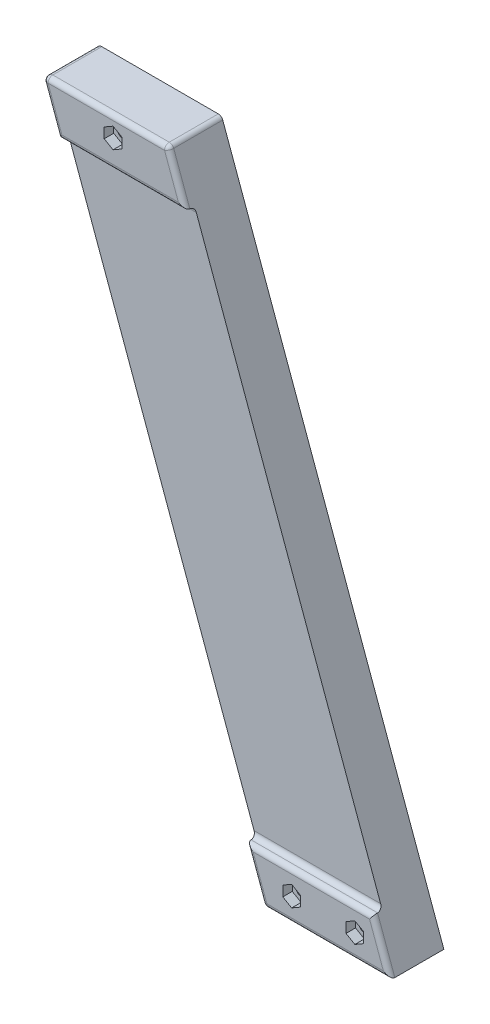
from build123d import *

# Parameters (mm, degrees)
SKETCH2_R           = 1.6
BOSS_EXTRUDE1_DEPTH = 17
SKETCH2_17_R        = 1.6
BOSS_EXTRUDE2_DEPTH = 6
CUT_EXTRUDE1_DEPTH  = 3
CUT_EXTRUDE2_DEPTH  = 3
FILLET1_R           = 1.5
CHAMFER3_SIZE       = 1


# Some blends are built 0.0001 mm under size
with BuildPart() as part:
    # Sketch2 → Boss-Extrude1 (new body)
    with BuildSketch(Plane.XY):
        Polygon((-47.316130455, 164.5), (-52.0477435, 177.5), (-55.240276817, 177.5), (-119.71566449, 354.644671741), (-104.09954666, 354.644671741), (-104.09954666, 349.79492948), (-101.29954666, 348.178348727), (-98.49954666, 349.79492948), (-98.49954666, 354.644671741), (-86.075962148, 354.644671741), (-16.868961429, 164.5), (-13.676428112, 164.5), (-83.975339533, 357.644671741), (-124.00010851, 357.644671741), (-53.701197089, 164.5), align=None)
        with Locations((-101.29954666, 351.411510234)):
            Circle(SKETCH2_R, mode=Mode.SUBTRACT)
    extrude(amount=-BOSS_EXTRUDE1_DEPTH)

    # Sketch2<17> → Boss-Extrude2 (add)
    with BuildSketch(Plane.XY):
        Polygon((-52.0477435, 177.5), (-47.316130455, 164.5), (-16.868961429, 164.5), (-86.075962148, 354.644671741), (-98.49954666, 354.644671741), (-98.49954666, 349.79492948), (-101.29954666, 348.178348727), (-104.09954666, 349.79492948), (-104.09954666, 354.644671741), (-119.71566449, 354.644671741), (-55.240276817, 177.5), align=None)
        with Locations((-44.822322699, 172)):
            Circle(SKETCH2_17_R, mode=Mode.SUBTRACT)
        with Locations((-24.822322699, 172)):
            Circle(SKETCH2_17_R, mode=Mode.SUBTRACT)
    extrude(amount=-BOSS_EXTRUDE2_DEPTH)

    # Sketch2<18> → Cut-Extrude1 (cut)
    with BuildSketch(Plane.XY):
        Polygon((-24.822322699, 168.766838493), (-22.022322699, 170.383419246), (-22.022322699, 173.616580754), (-24.822322699, 175.233161507), (-27.622322699, 173.616580754), (-27.622322699, 170.383419246), align=None)
        Polygon((-44.822322699, 168.766838493), (-42.022322699, 170.383419246), (-42.022322699, 173.616580754), (-44.822322699, 175.233161507), (-47.622322699, 173.616580754), (-47.622322699, 170.383419246), align=None)
        Polygon((-101.29954666, 354.644671741), (-104.09954666, 353.028090988), (-104.09954666, 349.79492948), (-101.29954666, 348.178348727), (-98.49954666, 349.79492948), (-98.49954666, 353.028090988), align=None)
    extrude(amount=-CUT_EXTRUDE1_DEPTH, mode=Mode.SUBTRACT)

    # Sketch5 → Cut-Extrude2 (cut)
    with BuildSketch(Plane.XY):
        Polygon((-118.540554996, 342.644671741), (-78.515786019, 342.644671741), (-19.135981626, 179.5), (-59.160750603, 179.5), align=None)
    extrude(amount=-CUT_EXTRUDE2_DEPTH, mode=Mode.SUBTRACT)

    # Fillet1
    fillet1_edges = [part.edges().sort_by_distance(p)[0] for p in [
        (-121.270331753, 350.144671741, 0),
        (-81.245562776, 350.144671741, 0),
        (-39.148366115, 179.5, 0),
        (-98.528170508, 342.644671741, 0),
        (-98.528170508, 342.644671741, -3),
        (-39.148366115, 179.5, -3),
        (-56.430973846, 172, 0),
        (-103.987724022, 357.644671741, 0),
        (-16.406204869, 172, 0),
        (-33.688812601, 164.5, 0),
        (-53.701197089, 164.5, -8.5),
        (-124.00010851, 357.644671741, -8.5),
        (-83.975339533, 357.644671741, -8.5),
    ]]
    fillet(fillet1_edges, radius=FILLET1_R - 0.0001)  # a hair under: the kernel refuses the full size

    # Chamfer2
    # the kernel refuses this chamfer: 3.34631437, 2 mm, written as the material it adds along each edge
    with BuildSketch(Plane(origin=(-55.240276817, 177.5, -6), x_dir=(0.9998669641130704, -0.01631116413110759, 0), z_dir=(0, 0, -1))) as chamfer2_piece_1_section:
        with BuildLine():
            Line((3.468087381, 0), (-0.836822437, -1.922560005))
            Line((-0.836822437, -1.922560005), (-0.899330844, -1.898647101))
            ThreePointArc((-0.899330844, -1.898647101), (-0.436719507, -0.954276075), (-0.062508407, 0.023912905))
            Line((-0.062508407, 0.023912905), (0.001091646, 0.066917384))
            ThreePointArc((0.001091646, 0.066917384), (1.734673987, 0.038636875), (3.469179027, 0.066917384))
            Line((3.469179027, 0.066917384), (3.468087381, 0))
        make_face()
    chamfer2_piece_1 = extrude(amount=11, mode=Mode.PRIVATE)
    chamfer2_piece_1 = split(chamfer2_piece_1, bisect_by=Plane(origin=(-52.5138481, 178.780611864, -11.5), z_dir=(-0.9396926207859072, -0.34202014332567215, 0)), keep=Keep.TOP, mode=Mode.PRIVATE)
    add(chamfer2_piece_1)

    # Chamfer3
    chamfer3_edges = [part.edges().sort_by_distance(p)[0] for p in [
        (-87.819990797, 267.012028492, -17),
        (-111.907605575, 354.644671741, -17),
    ]]
    chamfer(chamfer3_edges, length=CHAMFER3_SIZE)


solid = part.part
